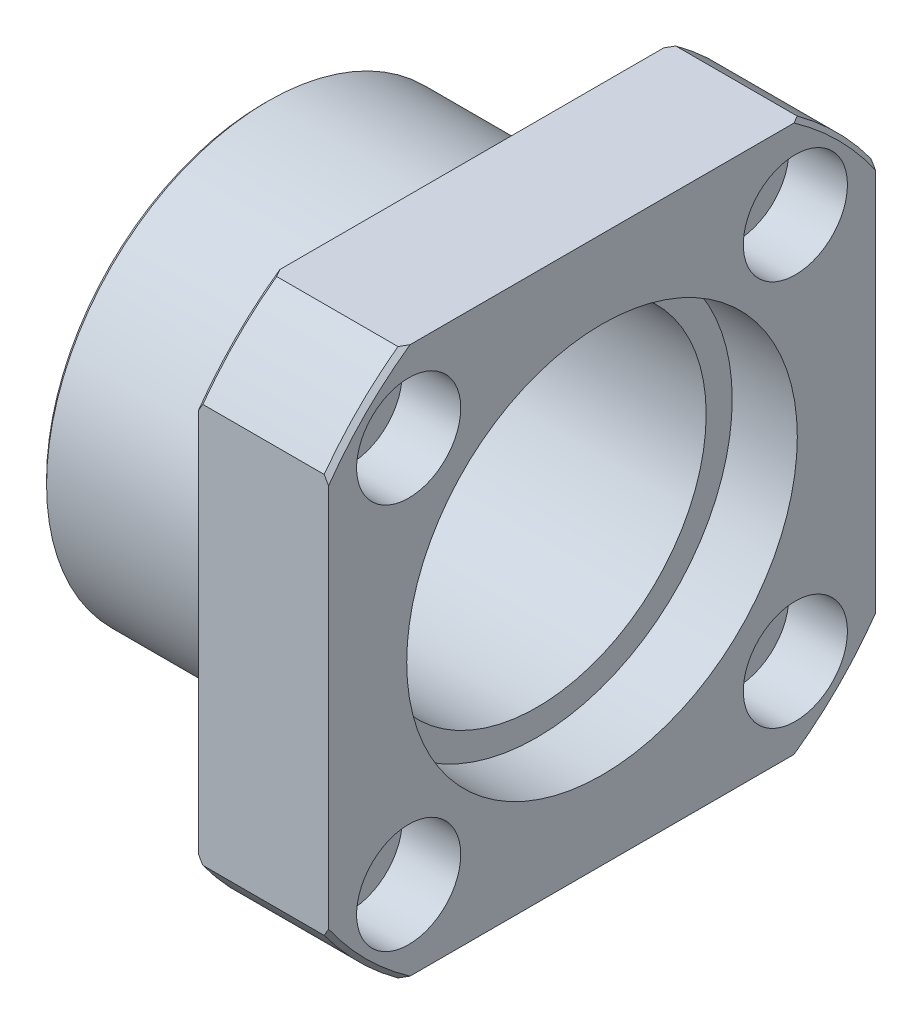
from build123d import *

# Parameters (mm, degrees)
BOSS_EXTRUDE1_DEPTH                              = 10
SKETCH2_W                                        = 16
SKETCH2_H                                        = 17
CBORE_FOR_M4_HEX_HEAD_MACHINE_SCREW1_D           = 4.5
CBORE_FOR_M4_HEX_HEAD_MACHINE_SCREW1_DEPTH       = 26
CBORE_FOR_M4_HEX_HEAD_MACHINE_SCREW1_CBORE_D     = 8
CBORE_FOR_M4_HEX_HEAD_MACHINE_SCREW1_CBORE_DEPTH = 4.5
CHAMFER1_SIZE                                    = 0.34
FILLET1_R                                        = 0.3


with BuildPart() as part:
    # Sketch1 → Boss-Extrude1 (new body)
    with BuildSketch(Plane(origin=(26, 0, 0), x_dir=(0, 0, -1), z_dir=(1, 0, 0))):
        with BuildLine():
            Line((21, -15.329709717), (21, 15.329709717))
            ThreePointArc((21, 15.329709717), (18.384776311, 18.384776311), (15.329709717, 21))
            Line((15.329709717, 21), (-15.329709717, 21))
            ThreePointArc((-15.329709717, 21), (-18.384776311, 18.384776311), (-21, 15.329709717))
            Line((-21, 15.329709717), (-21, -15.329709717))
            ThreePointArc((-21, -15.329709717), (-18.384776311, -18.384776311), (-15.329709717, -21))
            Line((-15.329709717, -21), (15.329709717, -21))
            ThreePointArc((15.329709717, -21), (18.384776311, -18.384776311), (21, -15.329709717))
        make_face()
    extrude(amount=-BOSS_EXTRUDE1_DEPTH)

    # Sketch2 → Revolve1 (revolve)
    with BuildSketch(Plane.XY):
        with Locations((8, 8.5)):
            Rectangle(SKETCH2_W, SKETCH2_H)
    revolve(axis=Axis((0, 0, 0), (1, 0, 0)))

    # Sketch3 → Cut-Revolve1 (revolve, cut)
    with BuildSketch(Plane.XY):
        Polygon((0, 7.25), (0, 0), (26, 0), (26, 15), (21, 15), (21, 13), (5, 13), (5, 7.25), align=None)
    revolve(axis=Axis((0, 0, 0), (1, 0, 0)), mode=Mode.SUBTRACT)

    # CBORE for M4 Hex Head Machine Screw1
    with Locations(Plane(origin=(26, 0, 0), x_dir=(0, 0, -1), z_dir=(1, 0, 0))):
        with Locations((-14.849242405, 14.849242405), (14.849242405, -14.849242405), (14.849242405, 14.849242405), (-14.849242405, -14.849242405)):
            CounterBoreHole(CBORE_FOR_M4_HEX_HEAD_MACHINE_SCREW1_D / 2, CBORE_FOR_M4_HEX_HEAD_MACHINE_SCREW1_CBORE_D / 2, CBORE_FOR_M4_HEX_HEAD_MACHINE_SCREW1_CBORE_DEPTH, depth=CBORE_FOR_M4_HEX_HEAD_MACHINE_SCREW1_DEPTH)

    # Chamfer1
    chamfer1_edges = [part.edges().sort_by_distance(p)[0] for p in [
        (16, -18.384776311, -18.384776311),
        (16, 18.384776311, 18.384776311),
        (26, 18.384776311, -18.384776311),
        (16, -18.384776311, 18.384776311),
        (26, -18.384776311, 18.384776311),
        (0, -17, 0),
        (26, 18.384776311, 18.384776311),
        (26, -18.384776311, -18.384776311),
        (16, 18.384776311, -18.384776311),
    ]]
    chamfer(chamfer1_edges, length=CHAMFER1_SIZE)

    # Fillet1
    fillet1_edges = [part.edges().sort_by_distance(p)[0] for p in [
        (16, -17, 0),
    ]]
    fillet(fillet1_edges, radius=FILLET1_R)


solid = part.part
